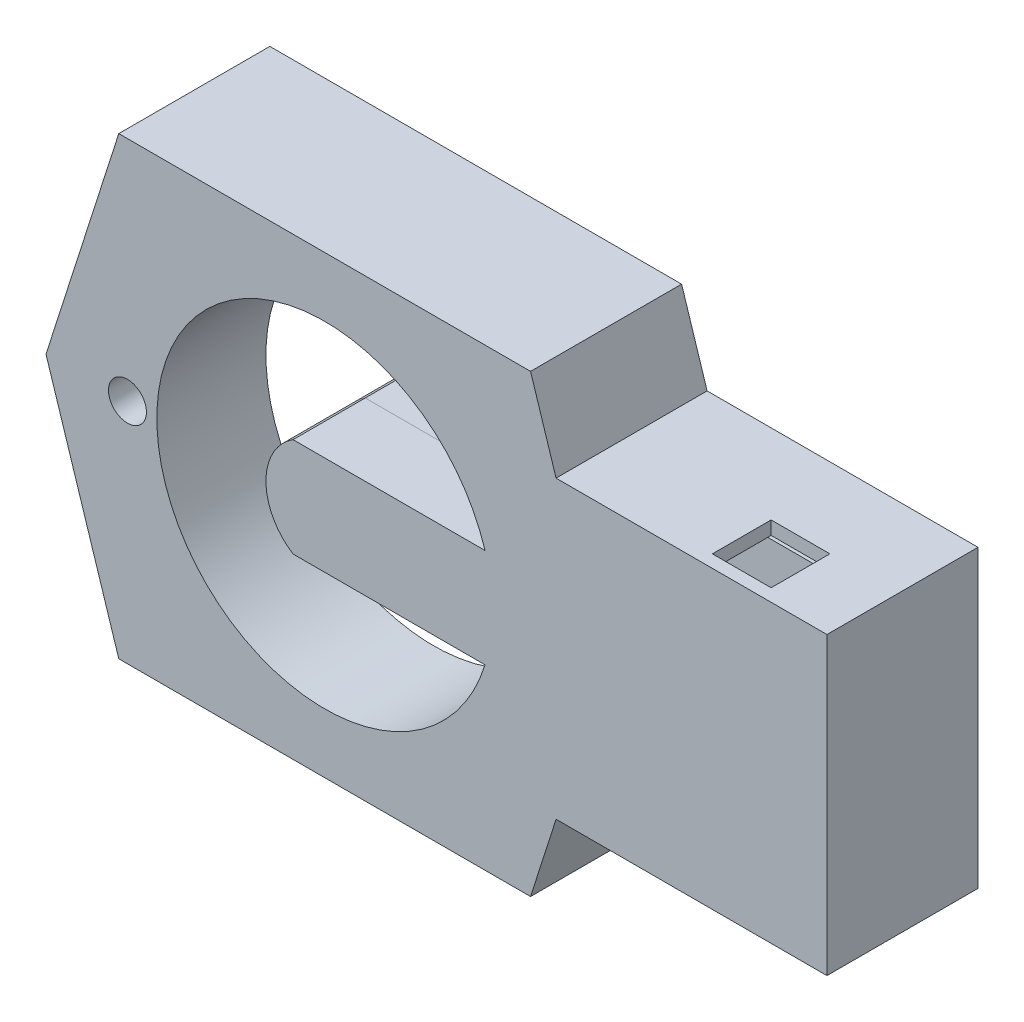
from build123d import *

# Parameters (mm, degrees)
BOSS_EXTRUDE1_DEPTH      = 10
BOSS_EXTRUDE1_DEPTH_BACK = 5
BOSS_EXTRUDE2_DEPTH      = 15
CUT_EXTRUDE1_DEPTH       = 68.168221653
BOSS_EXTRUDE3_DEPTH      = 4
SKETCH7_R                = 1.75
BOSS_EXTRUDE4_DEPTH      = 2.4
SKETCH8_R                = 3.5
BOSS_EXTRUDE5_DEPTH      = 1
CUT_EXTRUDE2_DEPTH       = 10
BOSS_EXTRUDE7_START      = 14
BOSS_EXTRUDE7_DEPTH      = 14
RIB9_START               = -9
RIB9_DEPTH               = 9
CUT_EXTRUDE3_DEPTH       = 5
SKETCH18_R               = 2.259673145
CUT_EXTRUDE4_DEPTH       = 68.168221653
SKETCH20_R               = 3.5
SKETCH20_W               = 8.6
SKETCH20_H               = 8.6
BOSS_EXTRUDE8_DEPTH      = 1
SKETCH21_W               = 7
SKETCH21_H               = 1.6
CUT_EXTRUDE5_DEPTH       = 7
BOSS_EXTRUDE11_DEPTH     = 2
SKETCH25_W               = 26.6
SKETCH25_H               = 26.1
BOSS_EXTRUDE12_DEPTH     = 1
BOSS_EXTRUDE13_DEPTH     = 4
CUT_EXTRUDE6_START       = -4
CUT_EXTRUDE6_DEPTH       = 4
BOSS_EXTRUDE14_DEPTH     = 1.6
BOSS_EXTRUDE16_START     = 2
SKETCH30_R               = 2.259673145
BOSS_EXTRUDE16_DEPTH     = 2
MOVE_FACE2_BY            = 2.8
MOVE_FACE2_2_BY          = 2.8
MOVE_START               = 14.5
MOVE_FACE3_OUTLINE_W     = 7
MOVE_FACE3_OUTLINE_H     = 1.5
MOVE_FACE3_DEPTH         = 1.6
MOVE_FACE3_2_OUTLINE_W   = 7
MOVE_FACE3_2_OUTLINE_H   = 1.5
MOVE_FACE3_2_DEPTH       = 1.6
MOVE_START_2             = 7
MOVE_FACE4_OUTLINE_W     = 29
MOVE_FACE4_OUTLINE_H     = 1.5
MOVE_FACE4_DEPTH         = 12.6
MOVE_START_3             = 19.6
MOVE_FACE4_2_OUTLINE_W   = 7.7
MOVE_FACE4_2_OUTLINE_H   = 1.5
MOVE_FACE4_2_OUTLINE_W_2 = 6.3
MOVE_FACE4_2_DEPTH       = 3.4
MOVE_FACE4_3_OUTLINE_W   = 1.6
MOVE_FACE4_3_OUTLINE_H   = 1.5
MOVE_FACE4_3_DEPTH       = 9.4
MOVE_FACE4_4_DEPTH       = 1.4
MOVE_FACE4_5_OUTLINE_W   = 7.9
MOVE_FACE4_5_OUTLINE_H   = 1.5
MOVE_FACE4_5_DEPTH       = 17
MOVE_FACE4_6_OUTLINE_W   = 7
MOVE_FACE4_6_OUTLINE_H   = 1.5
MOVE_FACE4_6_DEPTH       = 9.5
MOVE_START_4             = 23.5
MOVE_FACE4_7_OUTLINE_W   = 7
MOVE_FACE4_7_OUTLINE_H   = 1.5
MOVE_FACE4_7_DEPTH       = 0.5
MOVE_FACE6_OUTLINE_W     = 29
MOVE_FACE6_OUTLINE_H     = 1.5
MOVE_FACE6_DEPTH         = 12.6
MOVE_FACE6_2_OUTLINE_W   = 1.6
MOVE_FACE6_2_OUTLINE_H   = 1.5
MOVE_FACE6_2_DEPTH       = 9.4
MOVE_FACE6_3_DEPTH       = 1.4
MOVE_FACE6_4_DEPTH       = 17
BOSS_EXTRUDE17_DEPTH     = 8
MOVE_START_5             = 31.4
MOVE_FACE8_OUTLINE_W     = 23.7
MOVE_FACE8_OUTLINE_H     = 0.5
MOVE_FACE8_DEPTH         = 26.6
MOVE_START_6             = 37
MOVE_FACE8_2_OUTLINE_W   = 3.9
MOVE_FACE8_2_OUTLINE_H   = 0.5
MOVE_FACE8_2_DEPTH       = 21
MOVE_FACE9_BY            = 1
MOVE_FACE10_BY           = 0.25
MOVE_FACE10_2_BY         = 0.25


# Read off the part's stored shape, not the designer's step: Rib9, Move Face3, Move Face4, Move Face6, Move Face8
with BuildPart() as part:
    # Sketch2 → Boss-Extrude1 (new, two sides: drawn at the far end of the back side and taken through both)
    with BuildSketch(Plane.XY.offset(12).offset(-BOSS_EXTRUDE1_DEPTH_BACK)):
        Polygon((-24.532899998, 27.1), (-33.204899998, 0), (-24.532899998, -27.1), (24.532899998, -27.1), (33.204899998, 0), (24.532899998, 27.1), align=None)
        Polygon((-23.36497619, 25.5), (-31.52497619, 0), (-23.36497619, -25.5), (23.36497619, -25.5), (31.52497619, 0), (23.36497619, 25.5), align=None, mode=Mode.SUBTRACT)
    extrude(amount=BOSS_EXTRUDE1_DEPTH + BOSS_EXTRUDE1_DEPTH_BACK)

    # Sketch3 → Boss-Extrude2 (add)
    with BuildSketch(Plane.XY.offset(22)):
        Polygon((29.5, 16.1), (59.6, 16.1), (59.6, -16.1), (29.5, -16.1), (28.052899998, -16.1), (28.564899998, -14.5), (29.5, -14.5), (58, -14.5), (58, 14.5), (29.5, 14.5), (28.564899998, 14.5), (28.052899998, 16.1), align=None)
    extrude(amount=-BOSS_EXTRUDE2_DEPTH)

    # Sketch4 → Cut-Extrude1 (cut, through all)
    with BuildSketch(Plane(origin=(0, 0, 7), x_dir=(-1, 0, 0), z_dir=(0, 0, -1))):
        Polygon((-26.88497619, 14.5), (-28.564899998, 14.5), (-33.204899998, 0), (-28.564899998, -14.5), (-26.88497619, -14.5), (-31.52497619, 0), align=None)
    extrude(amount=-CUT_EXTRUDE1_DEPTH, mode=Mode.SUBTRACT)

    # Sketch5 → Boss-Extrude3 (add)
    with BuildSketch(Plane.XY.offset(22)):
        Polygon((29, 4.3), (29, 14), (29, 14.5), (27.4, 14.5), (27.4, 14), (27.4, 5.9), (-4.6, 5.9), (-4.6, -5.9), (27.4, -5.9), (27.4, -14), (27.4, -14.5), (29, -14.5), (29, -14), (29, -4.3), (-3, -4.3), (-3, 4.3), align=None)
    extrude(amount=-BOSS_EXTRUDE3_DEPTH)

    # Sketch7 → Boss-Extrude4 (add)
    with BuildSketch(Plane.XY.offset(22)):
        Polygon((37, 12.1), (37, 14.5), (29, 14.5), (29, 4.3), (5.6, 4.3), (5.6, -4.3), (29, -4.3), (29, -14.5), (58, -14.5), (58, -11.6), (31.4, -11.6), (31.4, 12.1), align=None)
        with Locations((23.5, 0)):
            Circle(SKETCH7_R, mode=Mode.SUBTRACT)
    extrude(amount=-BOSS_EXTRUDE4_DEPTH)

    # Sketch8 → Boss-Extrude5 (add)
    with BuildSketch(Plane.XY.offset(22)):
        Polygon((27.4, -5.9), (27.4, -14.5), (26.88497619, -14.5), (23.36497619, -25.5), (-23.36497619, -25.5), (-31.52497619, 0), (-23.36497619, 25.5), (23.36497619, 25.5), (26.88497619, 14.5), (27.4, 14.5), (27.4, 5.9), (-4.6, 5.9), (-4.6, -5.9), align=None)
        with Locations((-18.25, 18.25)):
            Circle(SKETCH8_R, mode=Mode.SUBTRACT)
        with Locations((18.25, 18.25)):
            Circle(SKETCH8_R, mode=Mode.SUBTRACT)
        with Locations((18.25, -18.25)):
            Circle(SKETCH8_R, mode=Mode.SUBTRACT)
        with Locations((-18.25, -18.25)):
            Circle(SKETCH8_R, mode=Mode.SUBTRACT)
    extrude(amount=-BOSS_EXTRUDE5_DEPTH)

    # Sketch11 → Cut-Extrude2 (cut)
    with BuildSketch(Plane(origin=(0, 0, 21), x_dir=(-1, 0, 0), z_dir=(0, 0, -1))):
        with BuildLine():
            Line((4.6, -5.9), (-19.109945055, -5.9))
            ThreePointArc((-19.109945055, -5.9), (2.983378865, -19.776234489), (20, 0))
            ThreePointArc((20, 0), (2.983378865, 19.776234489), (-19.109945055, 5.9))
            Line((-19.109945055, 5.9), (4.6, 5.9))
            Line((4.6, 5.9), (4.6, -5.9))
        make_face()
    extrude(amount=-CUT_EXTRUDE2_DEPTH, mode=Mode.SUBTRACT)

    # Sketch12 → Boss-Extrude7 (add)
    with BuildSketch(Plane(origin=(0, 0, 21), x_dir=(-1, 0, 0), z_dir=(0, 0, -1)).offset(BOSS_EXTRUDE7_START)):
        with BuildLine():
            ThreePointArc((21.6, 0), (2.978452055, 21.393663159), (-20.778594755, 5.9))
            Line((-20.778594755, 5.9), (-19.109945055, 5.9))
            ThreePointArc((-19.109945055, 5.9), (20, 0), (-19.109945055, -5.9))
            Line((-19.109945055, -5.9), (-20.778594755, -5.9))
            ThreePointArc((-20.778594755, -5.9), (2.978452055, -21.393663159), (21.6, 0))
        make_face()
    extrude(amount=-BOSS_EXTRUDE7_DEPTH)

    # Rib9 outline → Rib9 (add)
    with BuildSketch(Plane(origin=(0, 0, 12), x_dir=(-1, 0, 0), z_dir=(0, 0, -1)).offset(RIB9_START)):
        with BuildLine():
            ThreePointArc((-0.8, 21.585180101), (0, 21.6), (0.8, 21.585180101))
            Line((0.8, 21.585180101), (0.8, 25.5))
            Line((0.8, 25.5), (-0.8, 25.5))
            Line((-0.8, 25.5), (-0.8, 21.585180101))
        make_face()
        with BuildLine():
            Line((26.359415795, 16.142376235), (18.293314313, 11.485410374))
            ThreePointArc((18.293314313, 11.485410374), (18.706148722, 10.8), (19.093314313, 10.099769728))
            Line((19.093314313, 10.099769728), (26.85842878, 14.582960656))
            Line((26.85842878, 14.582960656), (26.359415795, 16.142376235))
        make_face()
        with BuildLine():
            ThreePointArc((-19.093314313, 10.099769728), (-18.706148721, 10.8), (-18.293314313, 11.485410374))
            Line((-18.293314313, 11.485410374), (-26.359415795, 16.142376235))
            Line((-26.359415795, 16.142376235), (-26.85842878, 14.582960656))
            Line((-26.85842878, 14.582960656), (-19.093314313, 10.099769728))
        make_face()
        with BuildLine():
            Line((26.85842878, -14.582960656), (19.093314313, -10.099769728))
            ThreePointArc((19.093314313, -10.099769728), (18.706148722, -10.8), (18.293314313, -11.485410374))
            Line((18.293314313, -11.485410374), (26.359415795, -16.142376235))
            Line((26.359415795, -16.142376235), (26.85842878, -14.582960656))
        make_face()
        with BuildLine():
            Line((0.8, -25.5), (0.8, -21.585180101))
            ThreePointArc((0.8, -21.585180101), (0, -21.6), (-0.8, -21.585180101))
            Line((-0.8, -21.585180101), (-0.8, -25.5))
            Line((-0.8, -25.5), (0.8, -25.5))
        make_face()
        with BuildLine():
            Line((-26.359415795, -16.142376235), (-18.293314313, -11.485410374))
            ThreePointArc((-18.293314313, -11.485410374), (-18.706148721, -10.8), (-19.093314313, -10.099769728))
            Line((-19.093314313, -10.099769728), (-26.85842878, -14.582960656))
            Line((-26.85842878, -14.582960656), (-26.359415795, -16.142376235))
        make_face()
    extrude(amount=RIB9_DEPTH)

    # Sketch17 → Cut-Extrude3 (cut)
    with BuildSketch(Plane(origin=(0, 0, 7), x_dir=(-1, 0, 0), z_dir=(0, 0, -1))):
        with BuildLine():
            Line((-19.109945055, -5.9), (-20.778594755, -5.9))
            ThreePointArc((-20.778594755, -5.9), (21.6, 0), (-20.778594755, 5.9))
            Line((-20.778594755, 5.9), (-19.109945055, 5.9))
            ThreePointArc((-19.109945055, 5.9), (20, 0), (-19.109945055, -5.9))
        make_face()
    extrude(amount=-CUT_EXTRUDE3_DEPTH, mode=Mode.SUBTRACT)

    # Sketch18 → Cut-Extrude4 (cut, through all)
    with BuildSketch(Plane.XY.offset(22)):
        with Locations((-23.5, 0)):
            Circle(SKETCH18_R)
        with Locations((23.5, 0)):
            Circle(SKETCH18_R)
    extrude(amount=-CUT_EXTRUDE4_DEPTH, mode=Mode.SUBTRACT)

    # Sketch20 → Boss-Extrude8 (add)
    with BuildSketch(Plane.XY.offset(22)):
        with Locations((18.25, 18.25)):
            Circle(SKETCH20_R)
        with Locations((18.25, -18.25)):
            Circle(SKETCH20_R)
        with Locations((-18.25, -18.25)):
            Circle(SKETCH20_R)
        with Locations((-18.25, 18.25)):
            Circle(SKETCH20_R)
        with Locations((1.3, 0)):
            Rectangle(SKETCH20_W, SKETCH20_H)
    extrude(amount=-BOSS_EXTRUDE8_DEPTH)

    # Sketch21 → Cut-Extrude5 (cut)
    with BuildSketch(Plane.XY.offset(22)):
        with Locations((51, 15.3)):
            Rectangle(SKETCH21_W, SKETCH21_H)
    extrude(amount=-CUT_EXTRUDE5_DEPTH, mode=Mode.SUBTRACT)

    # Sketch26 → Boss-Extrude13 (add)
    with BuildSketch(Plane.XY.offset(22)):
        with BuildLine():
            ThreePointArc((-7, 0), (-6.371812929, -2.898275349), (-4.6, -5.276362383))
            Line((-4.6, -5.276362383), (-4.6, 0))
            Line((-4.6, 0), (-7, 0))
        make_face()
        with BuildLine():
            Line((-7, 0), (-4.6, 0))
            Line((-4.6, 0), (-4.6, 5.276362383))
            ThreePointArc((-4.6, 5.276362383), (-6.371812929, 2.898275349), (-7, 0))
        make_face()
    extrude(amount=-BOSS_EXTRUDE13_DEPTH)

    # Sketch28 → Cut-Extrude6 (cut)
    with BuildSketch(Plane(origin=(0, 0, 18), x_dir=(-1, 0, 0), z_dir=(0, 0, -1)).offset(CUT_EXTRUDE6_START)):
        with BuildLine():
            ThreePointArc((3.76696164, 5.9), (4.195085546, 5.603682473), (4.6, 5.276362383))
            Line((4.6, 5.276362383), (4.6, 5.9))
            Line((4.6, 5.9), (3.76696164, 5.9))
        make_face()
        with BuildLine():
            Line((3.76696164, -5.9), (4.6, -5.9))
            Line((4.6, -5.9), (4.6, -5.276362383))
            ThreePointArc((4.6, -5.276362383), (4.195085546, -5.603682473), (3.76696164, -5.9))
        make_face()
    extrude(amount=CUT_EXTRUDE6_DEPTH, mode=Mode.SUBTRACT)

    # Sketch29 → Boss-Extrude14 (add)
    with BuildSketch(Plane(origin=(0, 0, 18), x_dir=(-1, 0, 0), z_dir=(0, 0, -1))):
        with BuildLine():
            Line((3.76696164, 5.9), (-19.109945055, 5.9))
            Line((-19.109945055, 5.9), (-20.778594755, 5.9))
            Line((-20.778594755, 5.9), (-27.4, 5.9))
            Line((-27.4, 5.9), (-27.4, 14.5))
            Line((-27.4, 14.5), (-29, 14.5))
            Line((-29, 14.5), (-29, 4.3))
            Line((-29, 4.3), (3, 4.3))
            Line((3, 4.3), (3, -4.3))
            Line((3, -4.3), (-29, -4.3))
            Line((-29, -4.3), (-29, -14.5))
            Line((-29, -14.5), (-27.4, -14.5))
            Line((-27.4, -14.5), (-27.4, -5.9))
            Line((-27.4, -5.9), (-20.778594755, -5.9))
            Line((-20.778594755, -5.9), (-19.109945055, -5.9))
            Line((-19.109945055, -5.9), (3.76696164, -5.9))
            ThreePointArc((3.76696164, -5.9), (7, 0), (3.76696164, 5.9))
        make_face()
    extrude(amount=BOSS_EXTRUDE14_DEPTH)



with BuildPart() as body_2:
    # Sketch24 → Boss-Extrude11 (new body)
    with BuildSketch(Plane.XY.offset(22)):
        Polygon((59.6, 16.1), (29.8, 16.1), (29.8, 12.1), (29.8, -13.2), (59.6, -13.2), align=None)
        Polygon((58, 14.5), (58, -11.6), (31.4, -11.6), (31.4, 12.1), (31.4, 14.5), align=None, mode=Mode.SUBTRACT)
    extrude(amount=BOSS_EXTRUDE11_DEPTH)

    # Sketch25 → Boss-Extrude12 (add)
    with BuildSketch(Plane.XY.offset(24)):
        with Locations((44.7, 1.45)):
            Rectangle(SKETCH25_W, SKETCH25_H)
    extrude(amount=-BOSS_EXTRUDE12_DEPTH)


with BuildPart() as part_1:
    add(part.part)

    add(body_2.part)  # Boss-Extrude16 merges body 2
    # Sketch30 → Boss-Extrude16 (add)
    with BuildSketch(Plane.XY.offset(22).offset(BOSS_EXTRUDE16_START)):
        Polygon((54.5, 16.1), (54.5, 14.5), (58, 14.5), (58, -11.6), (31.4, -11.6), (31.4, 12.1), (37, 12.1), (37, 14.5), (47.5, 14.5), (47.5, 16.1), (28.052899998, 16.1), (24.532899998, 27.1), (-24.532899998, 27.1), (-33.204899998, 0), (-24.532899998, -27.1), (24.532899998, -27.1), (28.052899998, -16.1), (59.6, -16.1), (59.6, 16.1), align=None)
        with Locations(Location((-23.5, 0, 0), (0, 0, 328.750537773))):
            Circle(SKETCH30_R, mode=Mode.SUBTRACT)
        with BuildLine():
            Line((-3.76696164, 5.9), (19.109945055, 5.9))
            ThreePointArc((19.109945055, 5.9), (-20, 0), (19.109945055, -5.9))
            Line((19.109945055, -5.9), (-3.76696164, -5.9))
            ThreePointArc((-3.76696164, -5.9), (-7, 0), (-3.76696164, 5.9))
        make_face(mode=Mode.SUBTRACT)
    extrude(amount=-BOSS_EXTRUDE16_DEPTH)

    # Move Face2: a face moved outward by 2.8
    extrude(part_1.faces().sort_by_distance((54.5, 15.3, 18.5))[0], amount=MOVE_FACE2_BY, dir=(-1, 0, 0))

    # Move Face2 2: a face moved inward by 2.8
    extrude(part_1.faces().sort_by_distance((47.5, 15.3, 18.5))[0], amount=MOVE_FACE2_2_BY, dir=(-1, 0, 0), mode=Mode.SUBTRACT)

    # Move Face3 outline → Move Face3 (cut)
    with BuildSketch(Plane(origin=(0, 0, 0), x_dir=(1, 0, 0), z_dir=(0, 1, 0)).offset(MOVE_START)):
        with Locations((48.2, -22.75)):
            Rectangle(MOVE_FACE3_OUTLINE_W, MOVE_FACE3_OUTLINE_H)
    extrude(amount=MOVE_FACE3_DEPTH, mode=Mode.SUBTRACT)

    # Move Face3 2 outline → Move Face3 2 (add)
    with BuildSketch(Plane(origin=(0, 0, 0), x_dir=(1, 0, 0), z_dir=(0, 1, 0)).offset(MOVE_START)):
        with Locations((48.2, -15.75)):
            Rectangle(MOVE_FACE3_2_OUTLINE_W, MOVE_FACE3_2_OUTLINE_H)
    extrude(amount=MOVE_FACE3_2_DEPTH)

    # Move Face4 outline → Move Face4 (cut)
    with BuildSketch(Plane.XY.offset(MOVE_START_2)):
        Polygon((26.40497619, 16), (26.85842878, 14.582960656), (26.88497619, 14.5), (27.4, 14.5), (27.4, 16), align=None)
        with Locations((43.5, 15.25)):
            Rectangle(MOVE_FACE4_OUTLINE_W, MOVE_FACE4_OUTLINE_H)
    extrude(amount=MOVE_FACE4_DEPTH, mode=Mode.SUBTRACT)

    # Move Face4 2 outline → Move Face4 2 (cut)
    with BuildSketch(Plane.XY.offset(MOVE_START_3)):
        with Locations((40.85, 15.25)):
            Rectangle(MOVE_FACE4_2_OUTLINE_W, MOVE_FACE4_2_OUTLINE_H)
        with Locations((54.85, 15.25)):
            Rectangle(MOVE_FACE4_2_OUTLINE_W_2, MOVE_FACE4_2_OUTLINE_H)
    extrude(amount=MOVE_FACE4_2_DEPTH, mode=Mode.SUBTRACT)

    # Move Face4 3 outline → Move Face4 3 (cut)
    with BuildSketch(Plane.XY.offset(MOVE_START_2)):
        with Locations((28.2, 15.25)):
            Rectangle(MOVE_FACE4_3_OUTLINE_W, MOVE_FACE4_3_OUTLINE_H)
    extrude(amount=MOVE_FACE4_3_DEPTH, mode=Mode.SUBTRACT)

    # Move Face4 4 outline → Move Face4 4 (cut)
    with BuildSketch(Plane.XY.offset(MOVE_START_3)):
        Polygon((26.40497619, 16), (26.85842878, 14.582960656), (26.88497619, 14.5), (27.4, 14.5), (27.4, 16), align=None)
    extrude(amount=MOVE_FACE4_4_DEPTH, mode=Mode.SUBTRACT)

    # Move Face4 5 outline → Move Face4 5 (add)
    with BuildSketch(Plane.XY.offset(MOVE_START_2)):
        Polygon((28.052899998, 16.1), (44.7, 16.1), (44.7, 17.6), (27.572899998, 17.6), align=None)
        with Locations((55.65, 16.85)):
            Rectangle(MOVE_FACE4_5_OUTLINE_W, MOVE_FACE4_5_OUTLINE_H)
    extrude(amount=MOVE_FACE4_5_DEPTH)

    # Move Face4 6 outline → Move Face4 6 (add)
    with BuildSketch(Plane.XY.offset(MOVE_START_2)):
        with Locations((48.2, 16.85)):
            Rectangle(MOVE_FACE4_6_OUTLINE_W, MOVE_FACE4_6_OUTLINE_H)
    extrude(amount=MOVE_FACE4_6_DEPTH)

    # Move Face4 7 outline → Move Face4 7 (add)
    with BuildSketch(Plane.XY.offset(MOVE_START_4)):
        with Locations((48.2, 16.85)):
            Rectangle(MOVE_FACE4_7_OUTLINE_W, MOVE_FACE4_7_OUTLINE_H)
    extrude(amount=MOVE_FACE4_7_DEPTH)

    # Move Face6 outline → Move Face6 (cut)
    with BuildSketch(Plane.XY.offset(MOVE_START_2)):
        Polygon((26.85842878, -14.582960656), (26.40497619, -16), (27.4, -16), (27.4, -14.5), (26.88497619, -14.5), align=None)
        with Locations((43.5, -15.25)):
            Rectangle(MOVE_FACE6_OUTLINE_W, MOVE_FACE6_OUTLINE_H)
    extrude(amount=MOVE_FACE6_DEPTH, mode=Mode.SUBTRACT)

    # Move Face6 2 outline → Move Face6 2 (cut)
    with BuildSketch(Plane.XY.offset(MOVE_START_2)):
        with Locations((28.2, -15.25)):
            Rectangle(MOVE_FACE6_2_OUTLINE_W, MOVE_FACE6_2_OUTLINE_H)
    extrude(amount=MOVE_FACE6_2_DEPTH, mode=Mode.SUBTRACT)

    # Move Face6 3 outline → Move Face6 3 (cut)
    with BuildSketch(Plane.XY.offset(MOVE_START_3)):
        Polygon((26.85842878, -14.582960656), (26.40497619, -16), (27.4, -16), (27.4, -14.5), (26.88497619, -14.5), align=None)
    extrude(amount=MOVE_FACE6_3_DEPTH, mode=Mode.SUBTRACT)

    # Move Face6 4 outline → Move Face6 4 (add)
    with BuildSketch(Plane.XY.offset(MOVE_START_2)):
        Polygon((27.572899998, -17.6), (59.6, -17.6), (59.6, -16.1), (28.052899998, -16.1), align=None)
    extrude(amount=MOVE_FACE6_4_DEPTH)

    # Move Face8 outline → Move Face8 (cut)
    with BuildSketch(Plane.YZ.offset(MOVE_START_5)):
        with Locations((0.25, 23.25)):
            Rectangle(MOVE_FACE8_OUTLINE_W, MOVE_FACE8_OUTLINE_H)
    extrude(amount=MOVE_FACE8_DEPTH, mode=Mode.SUBTRACT)

    # Move Face8 2 outline → Move Face8 2 (cut)
    with BuildSketch(Plane.YZ.offset(MOVE_START_6)):
        with Locations((14.05, 23.25)):
            Rectangle(MOVE_FACE8_2_OUTLINE_W, MOVE_FACE8_2_OUTLINE_H)
    extrude(amount=MOVE_FACE8_2_DEPTH, mode=Mode.SUBTRACT)

    # Move Face9: a face moved outward by 1.0
    extrude(part_1.faces().sort_by_distance((15.261438499, 0, 24))[0], amount=MOVE_FACE9_BY, dir=(0, 0, 1))

    # Move Face10: a face moved outward by 0.25
    extrude(part_1.faces().sort_by_distance((59.6, 0, 16))[0], amount=MOVE_FACE10_BY, dir=(1, 0, 0))

    # Move Face10 2: a face moved inward by 0.25
    extrude(part_1.faces().sort_by_distance((58, 0.463565891, 15.038372093))[0], amount=MOVE_FACE10_2_BY, dir=(1, 0, 0), mode=Mode.SUBTRACT)


with BuildPart() as body_2_2:
    # Sketch38 → Boss-Extrude17 (new body)
    with BuildSketch(Plane(origin=(0, 0, 16.4), x_dir=(-1, 0, 0), z_dir=(0, 0, -1))):
        with BuildLine():
            Line((-57.5, -15.5), (-29, -15.5))
            Line((-29, -15.5), (-29, -16))
            Line((-29, -16), (-27.4, -16))
            Line((-27.4, -16), (-27.4, -5.9))
            Line((-27.4, -5.9), (3.76696164, -5.9))
            ThreePointArc((3.76696164, -5.9), (7, 0), (3.76696164, 5.9))
            Line((3.76696164, 5.9), (-27.4, 5.9))
            Line((-27.4, 5.9), (-27.4, 16))
            Line((-27.4, 16), (-29, 16))
            Line((-29, 16), (-29, 15.5))
            Line((-29, 15.5), (-57.5, 15.5))
            Line((-57.5, 15.5), (-57.5, -15.5))
        make_face()
    extrude(amount=BOSS_EXTRUDE17_DEPTH)


solid = Compound([part_1.part, body_2_2.part])
